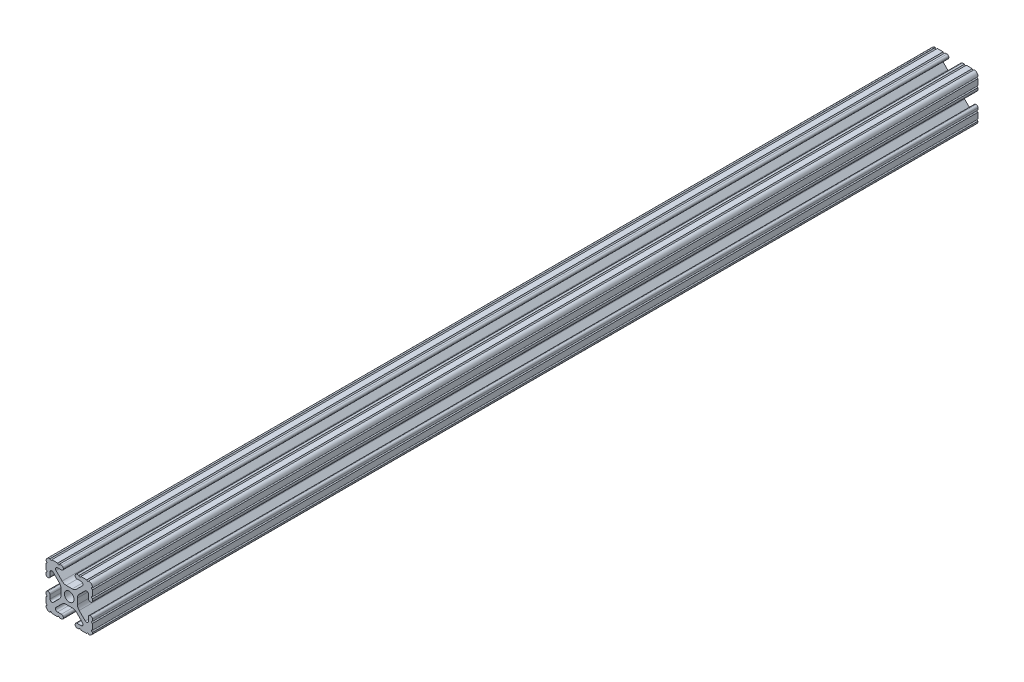
from build123d import *

# Parameters (mm, degrees)
SKETCH1_R           = 2.6035
BOSS_EXTRUDE1_DEPTH = 304.8
SKETCH2_W           = 30.080863632
SKETCH2_H           = 32.411853065
CUT_EXTRUDE1_DEPTH  = 125.73


with BuildPart() as part:
    # Sketch1 → Boss-Extrude1 (new, symmetric)
    with BuildSketch(Plane.XY):
        with BuildLine():
            Line((-7.179650497, -8.645192506), (-3.952270251, -5.423690499))
            ThreePointArc((-3.952270251, -5.423690499), (-2.922936451, -4.736929036), (-1.709253557, -4.4958))
            Line((-1.709253557, -4.4958), (1.709253557, -4.4958))
            ThreePointArc((1.709253557, -4.4958), (2.922936451, -4.736929036), (3.952270251, -5.423690499))
            Line((3.952270251, -5.423690499), (7.179650497, -8.645192506))
            ThreePointArc((7.179650497, -8.645192506), (7.41473083, -9.822813117), (6.416408329, -10.4902))
            Line((6.416408329, -10.4902), (4.287512407, -10.4902))
            ThreePointArc((4.287512407, -10.4902), (3.54574862, -10.79744862), (3.2385, -11.539212407))
            Line((3.2385, -11.539212407), (3.2385, -11.650987593))
            ThreePointArc((3.2385, -11.650987593), (3.54574862, -12.39275138), (4.287512407, -12.7))
            Line((4.287512407, -12.7), (5.317126718, -12.7))
            ThreePointArc((5.317126718, -12.7), (5.825126718, -12.192), (6.333126718, -12.7))
            Line((6.333126718, -12.7), (9.550443118, -12.7))
            ThreePointArc((9.550443118, -12.7), (10.058366869, -12.192000006), (10.566443095, -12.699847501))
            ThreePointArc((10.566443095, -12.699847501), (12.082537762, -12.08250727), (12.699846982, -10.566399977))
            ThreePointArc((12.699846982, -10.566399977), (12.192000006, -10.058323491), (12.7, -9.5504))
            Line((12.7, -9.5504), (12.7, -6.3330836))
            ThreePointArc((12.7, -6.3330836), (12.192, -5.8250836), (12.7, -5.3170836))
            Line((12.7, -5.3170836), (12.7, -4.287469289))
            ThreePointArc((12.7, -4.287469289), (12.39275138, -3.545705502), (11.650987593, -3.238456882))
            Line((11.650987593, -3.238456882), (11.539212407, -3.238456882))
            ThreePointArc((11.539212407, -3.238456882), (10.79744862, -3.545705502), (10.4902, -4.287469289))
            Line((10.4902, -4.287469289), (10.4902, -6.402089023))
            ThreePointArc((10.4902, -6.402089023), (9.856505071, -7.351067942), (8.737131347, -7.129408934))
            Line((8.737131347, -7.129408934), (5.441005833, -3.840816462))
            ThreePointArc((5.441005833, -3.840816462), (4.750877967, -2.809883091), (4.5085, -1.593185507))
            Line((4.5085, -1.593185507), (4.5085, 1.593185507))
            ThreePointArc((4.5085, 1.593185507), (4.750877967, 2.809883091), (5.441005833, 3.840816462))
            Line((5.441005833, 3.840816462), (8.737131347, 7.129408934))
            ThreePointArc((8.737131347, 7.129408934), (9.856505071, 7.351067942), (10.4902, 6.402089023))
            Line((10.4902, 6.402089023), (10.4902, 4.287469289))
            ThreePointArc((10.4902, 4.287469289), (10.79744862, 3.545705502), (11.539212407, 3.238456882))
            Line((11.539212407, 3.238456882), (11.650987593, 3.238456882))
            ThreePointArc((11.650987593, 3.238456882), (12.39275138, 3.545705502), (12.7, 4.287469289))
            Line((12.7, 4.287469289), (12.7, 5.3170836))
            ThreePointArc((12.7, 5.3170836), (12.192, 5.8250836), (12.7, 6.3330836))
            Line((12.7, 6.3330836), (12.7, 9.5504))
            ThreePointArc((12.7, 9.5504), (12.192000006, 10.058323491), (12.699846982, 10.566399977))
            ThreePointArc((12.699846982, 10.566399977), (12.082537762, 12.08250727), (10.566443095, 12.699847501))
            ThreePointArc((10.566443095, 12.699847501), (10.058366869, 12.192000006), (9.550443118, 12.7))
            Line((9.550443118, 12.7), (6.333126718, 12.7))
            ThreePointArc((6.333126718, 12.7), (5.825126718, 12.192), (5.317126718, 12.7))
            Line((5.317126718, 12.7), (4.287512407, 12.7))
            ThreePointArc((4.287512407, 12.7), (3.54574862, 12.39275138), (3.2385, 11.650987593))
            Line((3.2385, 11.650987593), (3.2385, 11.539212407))
            ThreePointArc((3.2385, 11.539212407), (3.54574862, 10.79744862), (4.287512407, 10.4902))
            Line((4.287512407, 10.4902), (6.476788598, 10.4902))
            ThreePointArc((6.476788598, 10.4902), (7.432222385, 9.85140422), (7.207036008, 8.724370562))
            Line((7.207036008, 8.724370562), (3.898272566, 5.423169045))
            ThreePointArc((3.898272566, 5.423169045), (2.869120213, 4.736787962), (1.655778399, 4.4958))
            Line((1.655778399, 4.4958), (-1.655778399, 4.4958))
            ThreePointArc((-1.655778399, 4.4958), (-2.869120213, 4.736787962), (-3.898272566, 5.423169045))
            Line((-3.898272566, 5.423169045), (-7.207036008, 8.724370562))
            ThreePointArc((-7.207036008, 8.724370562), (-7.432222385, 9.85140422), (-6.476788598, 10.4902))
            Line((-6.476788598, 10.4902), (-4.287512407, 10.4902))
            ThreePointArc((-4.287512407, 10.4902), (-3.54574862, 10.79744862), (-3.2385, 11.539212407))
            Line((-3.2385, 11.539212407), (-3.2385, 11.650987593))
            ThreePointArc((-3.2385, 11.650987593), (-3.54574862, 12.39275138), (-4.287512407, 12.7))
            Line((-4.287512407, 12.7), (-5.317126718, 12.7))
            ThreePointArc((-5.317126718, 12.7), (-5.825126718, 12.192), (-6.333126718, 12.7))
            Line((-6.333126718, 12.7), (-9.550443118, 12.7))
            ThreePointArc((-9.550443118, 12.7), (-10.058366869, 12.192000006), (-10.566443095, 12.699847501))
            ThreePointArc((-10.566443095, 12.699847501), (-12.082537762, 12.08250727), (-12.699846982, 10.566399977))
            ThreePointArc((-12.699846982, 10.566399977), (-12.192000006, 10.058323491), (-12.7, 9.5504))
            Line((-12.7, 9.5504), (-12.7, 6.3330836))
            ThreePointArc((-12.7, 6.3330836), (-12.192, 5.8250836), (-12.7, 5.3170836))
            Line((-12.7, 5.3170836), (-12.7, 4.287469289))
            ThreePointArc((-12.7, 4.287469289), (-12.39275138, 3.545705502), (-11.650987593, 3.238456882))
            Line((-11.650987593, 3.238456882), (-11.539212407, 3.238456882))
            ThreePointArc((-11.539212407, 3.238456882), (-10.79744862, 3.545705502), (-10.4902, 4.287469289))
            Line((-10.4902, 4.287469289), (-10.4902, 6.402089023))
            ThreePointArc((-10.4902, 6.402089023), (-9.856505071, 7.351067942), (-8.737131347, 7.129408934))
            Line((-8.737131347, 7.129408934), (-5.441005833, 3.840816462))
            ThreePointArc((-5.441005833, 3.840816462), (-4.750877967, 2.809883091), (-4.5085, 1.593185507))
            Line((-4.5085, 1.593185507), (-4.5085, -1.593185507))
            ThreePointArc((-4.5085, -1.593185507), (-4.750877967, -2.809883091), (-5.441005833, -3.840816462))
            Line((-5.441005833, -3.840816462), (-8.737131347, -7.129408934))
            ThreePointArc((-8.737131347, -7.129408934), (-9.856505071, -7.351067942), (-10.4902, -6.402089023))
            Line((-10.4902, -6.402089023), (-10.4902, -4.287469289))
            ThreePointArc((-10.4902, -4.287469289), (-10.79744862, -3.545705502), (-11.539212407, -3.238456882))
            Line((-11.539212407, -3.238456882), (-11.650987593, -3.238456882))
            ThreePointArc((-11.650987593, -3.238456882), (-12.39275138, -3.545705502), (-12.7, -4.287469289))
            Line((-12.7, -4.287469289), (-12.7, -5.3170836))
            ThreePointArc((-12.7, -5.3170836), (-12.192, -5.8250836), (-12.7, -6.3330836))
            Line((-12.7, -6.3330836), (-12.7, -9.5504))
            ThreePointArc((-12.7, -9.5504), (-12.192000006, -10.058323491), (-12.699846982, -10.566399977))
            ThreePointArc((-12.699846982, -10.566399977), (-12.082537762, -12.08250727), (-10.566443095, -12.699847501))
            ThreePointArc((-10.566443095, -12.699847501), (-10.058366869, -12.192000006), (-9.550443118, -12.7))
            Line((-9.550443118, -12.7), (-6.333126718, -12.7))
            ThreePointArc((-6.333126718, -12.7), (-5.825126718, -12.192), (-5.317126718, -12.7))
            Line((-5.317126718, -12.7), (-4.287512407, -12.7))
            ThreePointArc((-4.287512407, -12.7), (-3.54574862, -12.39275138), (-3.2385, -11.650987593))
            Line((-3.2385, -11.650987593), (-3.2385, -11.539212407))
            ThreePointArc((-3.2385, -11.539212407), (-3.54574862, -10.79744862), (-4.287512407, -10.4902))
            Line((-4.287512407, -10.4902), (-6.416408329, -10.4902))
            ThreePointArc((-6.416408329, -10.4902), (-7.41473083, -9.822813117), (-7.179650497, -8.645192506))
        make_face()
        Circle(SKETCH1_R, mode=Mode.SUBTRACT)
    extrude(amount=BOSS_EXTRUDE1_DEPTH, both=True)

    # Sketch2 → Cut-Extrude1 (cut)
    with BuildSketch(Plane.XY.offset(304.8)):
        with Locations((-0.166499245, 0.33299849)):
            Rectangle(SKETCH2_W, SKETCH2_H)
    extrude(amount=-CUT_EXTRUDE1_DEPTH, mode=Mode.SUBTRACT)


solid = part.part
